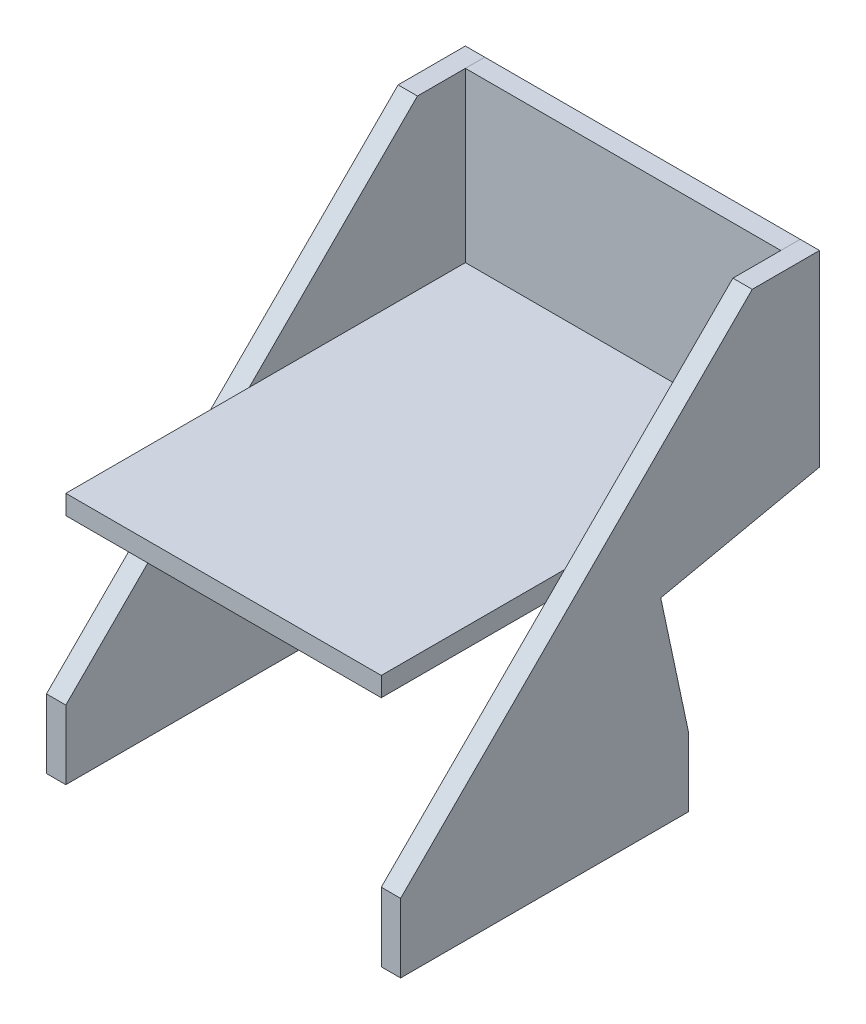
from build123d import *

# Parameters (mm, degrees)
SKETCH1_W               = 37.5
SKETCH1_H               = 47.5
BASE_FLANGE1_DEPTH      = 2.3
SKETCH9_W               = 49.8
SKETCH9_H               = 50
BASE_FLANGE2_DEPTH      = 2.3
SKETCH12_W              = 37.5
SKETCH12_H              = 22.3
BASE_FLANGE3_DEPTH      = 2.3
SKETCH15_W              = 49.8
SKETCH15_H              = 50
BASE_FLANGE4_DEPTH      = 2.3
CUT_EXTRUDE1_DEPTH      = 58.887930521
CUT_EXTRUDE1_DEPTH_BACK = 58.887930521
CUT_EXTRUDE2_DEPTH      = 58.887930521
CUT_EXTRUDE2_DEPTH_BACK = 58.887930521


# Sheet-metal steps are written as plain solids
with BuildPart() as part:
    # Sketch1 → Base-Flange1 (new body)
    with BuildSketch(Plane(origin=(0, 0, 0), x_dir=(1, 0, 0), z_dir=(0, 1, 0))):
        Rectangle(SKETCH1_W, SKETCH1_H)
    extrude(amount=-BASE_FLANGE1_DEPTH)


with BuildPart() as body_2:
    # Sketch9 → Base-Flange2 (new body)
    with BuildSketch(Plane.ZY.offset(18.75)):
        with Locations((-1.15, -5)):
            Rectangle(SKETCH9_W, SKETCH9_H)
    extrude(amount=BASE_FLANGE2_DEPTH)


with BuildPart() as body_3:
    # Sketch12 → Base-Flange3 (new body)
    with BuildSketch(Plane(origin=(0, 0, -23.75), x_dir=(-1, 0, 0), z_dir=(0, 0, -1))):
        with Locations((0, 8.85)):
            Rectangle(SKETCH12_W, SKETCH12_H)
    extrude(amount=BASE_FLANGE3_DEPTH)


with BuildPart() as body_4:
    # Sketch15 → Base-Flange4 (new body)
    with BuildSketch(Plane(origin=(18.75, 0, 0), x_dir=(0, 0, -1), z_dir=(1, 0, 0))):
        with Locations((1.15, -5)):
            Rectangle(SKETCH15_W, SKETCH15_H)
    extrude(amount=BASE_FLANGE4_DEPTH)


with BuildPart() as cut_extrude1_tool:
    # Sketch18 → Cut-Extrude1 (new, two sides: drawn at the far end of the back side and taken through both)
    with BuildSketch(Plane.ZY.offset(21.05).offset(-CUT_EXTRUDE1_DEPTH_BACK)):
        Polygon((-18.05, 20), (23.75, -21.8), (23.75, 20), align=None)
    extrude(amount=CUT_EXTRUDE1_DEPTH + CUT_EXTRUDE1_DEPTH_BACK)


with BuildPart() as body_2_1:
    add(body_2.part)

    # Cut-Extrude1: cut by cut_extrude1_tool
    add(cut_extrude1_tool.part, mode=Mode.SUBTRACT)


with BuildPart() as body_4_1:
    add(body_4.part)

    # Cut-Extrude1: cut by cut_extrude1_tool
    add(cut_extrude1_tool.part, mode=Mode.SUBTRACT)


with BuildPart() as cut_extrude2_tool:
    # Sketch19 → Cut-Extrude2 (new, two sides: drawn at the far end of the back side and taken through both)
    with BuildSketch(Plane.ZY.offset(21.05).offset(-CUT_EXTRUDE2_DEPTH_BACK)):
        Polygon((-26.05, -2.3), (-7.174048239, -6.32706006), (-10.475098127, -21.8), (-10.475098127, -30), (-26.05, -30), align=None)
    extrude(amount=CUT_EXTRUDE2_DEPTH + CUT_EXTRUDE2_DEPTH_BACK)


with BuildPart() as body_2_2:
    add(body_2_1.part)

    # Cut-Extrude2: cut by cut_extrude2_tool
    add(cut_extrude2_tool.part, mode=Mode.SUBTRACT)


with BuildPart() as body_4_2:
    add(body_4_1.part)

    # Cut-Extrude2: cut by cut_extrude2_tool
    add(cut_extrude2_tool.part, mode=Mode.SUBTRACT)


solid = Compound([part.part, body_3.part, body_2_2.part, body_4_2.part])
